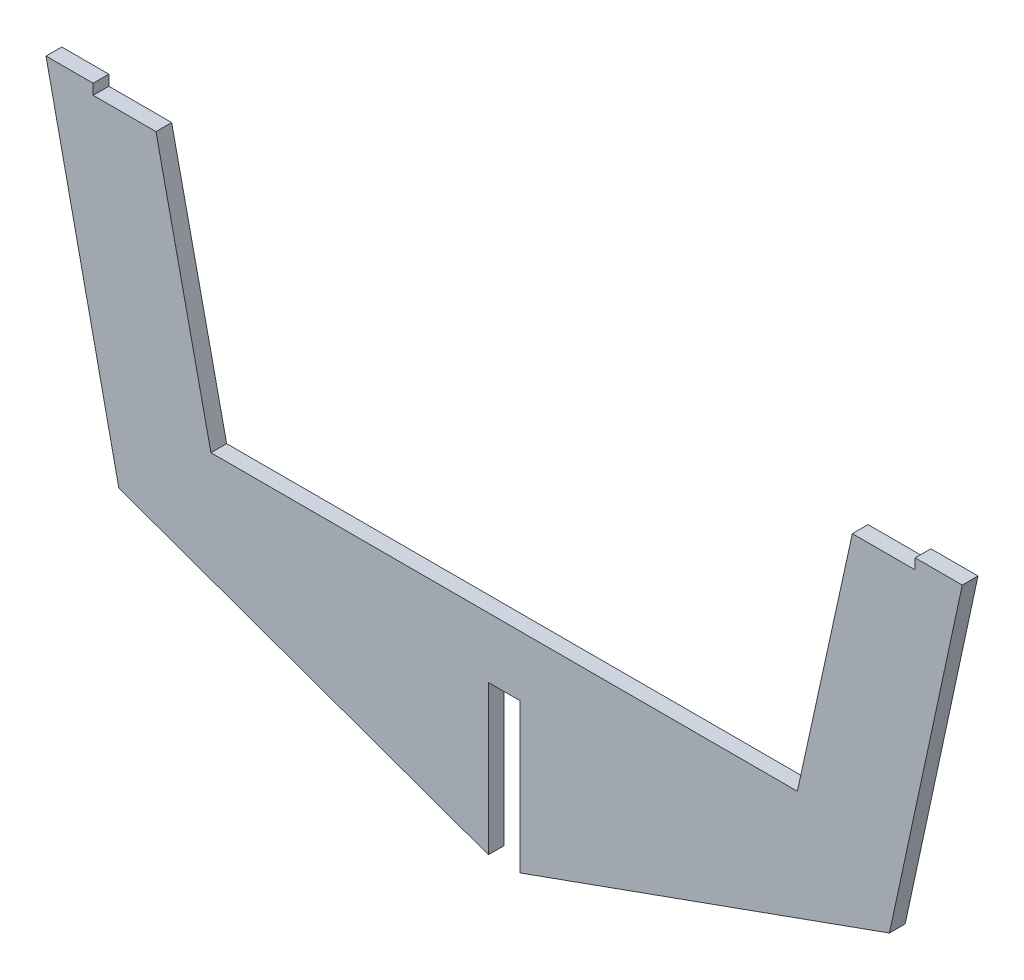
from build123d import *

# Parameters (mm, degrees)
BOSS_EXTRU_3_DEPTH = 3


with BuildPart() as part:
    # Esquisse3 → Boss.-Extru.3 (new body)
    with BuildSketch(Plane.XY):
        Polygon((-28.584593284, 68.110496697), (-19.584593284, 68.110496697), (-19.584593284, 66.110496697), (-7.584593284, 66.110496697), (2.915406716, 18.248716538), (45.960979242, 18.248716538), (71.86983419, 18.248716538), (114.915406716, 18.248716538), (125.415406716, 66.110496697), (137.415406716, 66.110496697), (137.415406716, 68.110496697), (146.415406716, 68.110496697), (132.503264436, 3.593426885), (82.884591786, -14.222255964), (61.915406716, -21.751283462), (61.915406716, 6.748716538), (55.915406716, 6.748716538), (55.915406716, -21.751283462), (34.946221647, -14.222255964), (-14.672451003, 3.593426885), align=None)
    extrude(amount=BOSS_EXTRU_3_DEPTH)


solid = part.part
